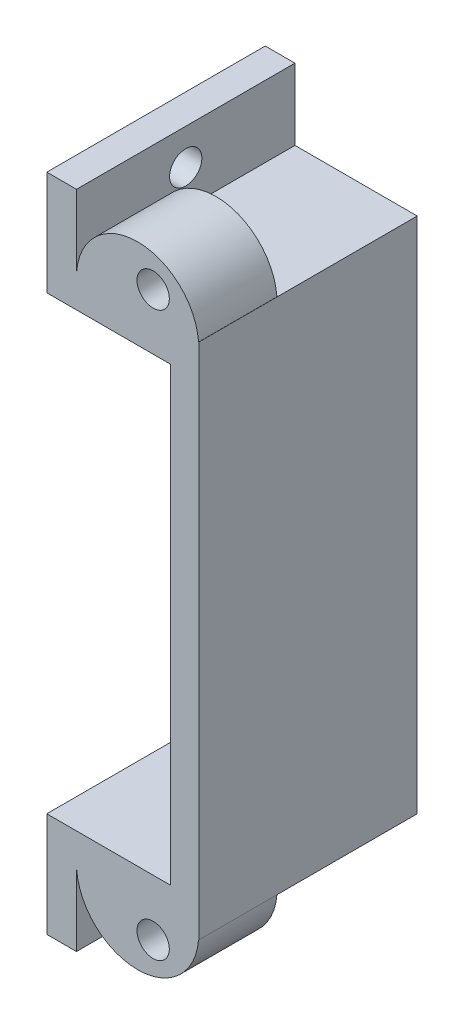
from build123d import *

# Parameters (mm, degrees)
BOSS_EXTRUDE1_DEPTH = 23
SKETCH2_R           = 1.7
CUT_EXTRUDE1_DEPTH  = 44.416132369
CUT_EXTRUDE5_START  = 23
SKETCH2_8_W         = 14.75
SKETCH2_8_H         = 7
SKETCH2_8_R         = 1.7
CUT_EXTRUDE5_DEPTH  = 23
SKETCH5_R           = 1.7
CUT_EXTRUDE6_DEPTH  = 45.833023543
SKETCH6_R           = 1.7
CUT_EXTRUDE7_DEPTH  = 23


with BuildPart() as part:
    # Sketch1 → Boss-Extrude1 (new body)
    with BuildSketch(Plane.XY):
        with BuildLine():
            Line((13, 24), (13, -24))
            Line((13, -24), (0, -24))
            Line((0, -24), (0, -34.5))
            Line((0, -34.5), (3.127139018, -34.5))
            Line((3.127139018, -34.5), (3.127139018, -27))
            Line((3.127139018, -27), (16, -27))
            Line((16, -27), (16, 27))
            ThreePointArc((16, 27), (9.563569509, 33.436430491), (3.127139018, 27))
            Line((3.127139018, 27), (3.127139018, 34.5))
            Line((3.127139018, 34.5), (0, 34.5))
            Line((0, 34.5), (0, 24))
            Line((0, 24), (13, 24))
        make_face()
    boss_extrude1 = extrude(amount=BOSS_EXTRUDE1_DEPTH)

    # Sketch2 → Cut-Extrude1 (cut, symmetric)
    with BuildSketch(Plane(origin=(3.127139018, 0, 0), x_dir=(0, 0, -1), z_dir=(1, 0, 0))):
        with Locations((-11.5, 30.75)):
            Circle(SKETCH2_R)
    cut_extrude1 = extrude(amount=CUT_EXTRUDE1_DEPTH, both=True, mode=Mode.SUBTRACT)

    # Sketch2<8> → Cut-Extrude5 (cut)
    with BuildSketch(Plane(origin=(3.127139018, 0, 0), x_dir=(0, 0, -1), z_dir=(1, 0, 0)).offset(CUT_EXTRUDE5_START)):
        with Locations((-7.375, 31)):
            Rectangle(SKETCH2_8_W, SKETCH2_8_H)
        with Locations((-11.5, 30.75)):
            Circle(SKETCH2_8_R, mode=Mode.SUBTRACT)
    cut_extrude5 = extrude(amount=-CUT_EXTRUDE5_DEPTH, mode=Mode.SUBTRACT)

    # Mirror5: Boss-Extrude1, Cut-Extrude1, Cut-Extrude5 across plane
    add(boss_extrude1.mirror(Plane(origin=(0, 0.25, 0), x_dir=(0, 0, 1), z_dir=(0, -1, 0))))
    add(cut_extrude1.mirror(Plane(origin=(0, 0.25, 0), x_dir=(0, 0, 1), z_dir=(0, -1, 0))), mode=Mode.SUBTRACT)
    add(cut_extrude5.mirror(Plane(origin=(0, 0.25, 0), x_dir=(0, 0, 1), z_dir=(0, -1, 0))), mode=Mode.SUBTRACT)

    # Sketch5 → Cut-Extrude6 (cut, through all)
    with BuildSketch(Plane.XY.offset(23)):
        with Locations((11.2, 29.9)):
            Circle(SKETCH5_R)
    cut_extrude6 = extrude(amount=-CUT_EXTRUDE6_DEPTH, mode=Mode.SUBTRACT)

    # Mirror8: Cut-Extrude6 across plane
    add(cut_extrude6.mirror(Plane(origin=(0, 0.25, 0), x_dir=(0, 0, 1), z_dir=(0, -1, 0))), mode=Mode.SUBTRACT)

    # Sketch6 → Cut-Extrude7 (cut)
    with BuildSketch(Plane(origin=(3.127139018, 0, 0), x_dir=(0, 0, -1), z_dir=(1, 0, 0))):
        with Locations((-11.5, 31.25)):
            Circle(SKETCH6_R)
    extrude(amount=-CUT_EXTRUDE7_DEPTH, mode=Mode.SUBTRACT)


solid = part.part
